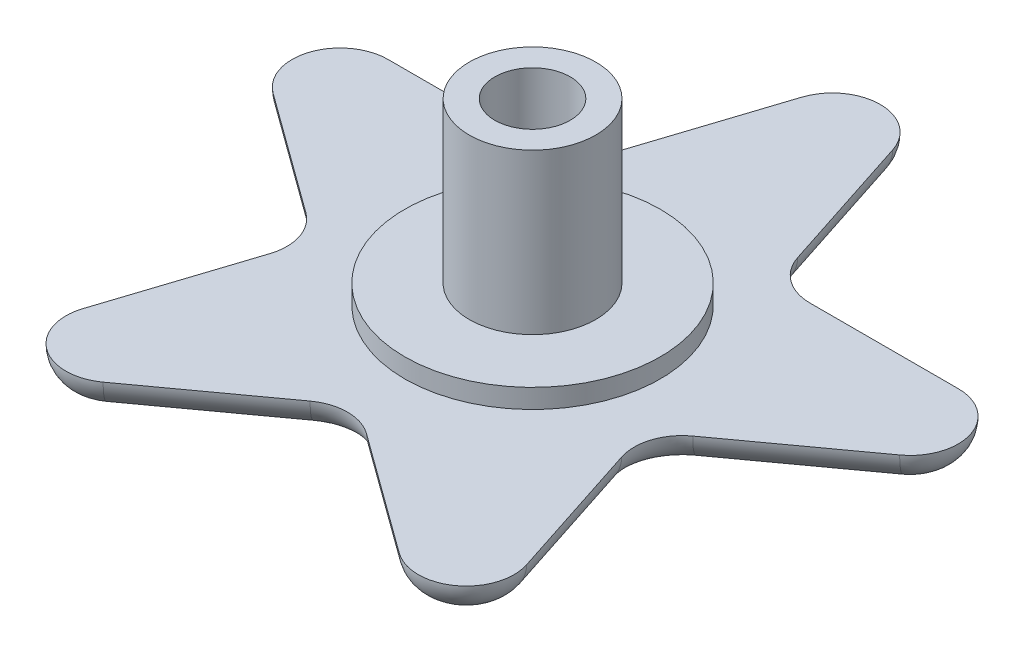
from build123d import *

# Parameters (mm, degrees)
SALIENTE_EXTRUIR1_DEPTH = 1
REDONDEO1_R             = 1
CROQUIS5_R              = 4
SALIENTE_EXTRUIR5_DEPTH = 0.6
CROQUIS2_R              = 1.98
CROQUIS2_R_2            = 1.18
SALIENTE_EXTRUIR2_DEPTH = 5


with BuildPart() as part:
    # Croquis1 → Saliente-Extruir1 (new body)
    with BuildSketch(Plane(origin=(0, 0, 0), x_dir=(1, 0, 0), z_dir=(0, 1, 0))):
        with BuildLine():
            Line((1.426584774, 9.845491503), (2.859425417, 5.435661447))
            ThreePointArc((2.859425417, 5.435661447), (3.404332313, 4.685661447), (4.286010191, 4.399186938))
            Line((4.286010191, 4.399186938), (8.922779911, 4.399186938))
            ThreePointArc((8.922779911, 4.399186938), (10.349364685, 3.36271243), (9.804457789, 1.685661447))
            Line((9.804457789, 1.685661447), (6.053232287, -1.039763413))
            ThreePointArc((6.053232287, -1.039763413), (5.508325391, -1.789763413), (5.508325391, -2.716814396))
            Line((5.508325391, -2.716814396), (6.941166033, -7.126644452))
            ThreePointArc((6.941166033, -7.126644452), (6.396259137, -8.803695435), (4.63290338, -8.803695435))
            Line((4.63290338, -8.803695435), (0.881677878, -6.078270576))
            ThreePointArc((0.881677878, -6.078270576), (0, -5.791796068), (-0.881677878, -6.078270576))
            Line((-0.881677878, -6.078270576), (-4.63290338, -8.803695435))
            ThreePointArc((-4.63290338, -8.803695435), (-6.396259137, -8.803695435), (-6.941166033, -7.126644452))
            Line((-6.941166033, -7.126644452), (-5.508325391, -2.716814396))
            ThreePointArc((-5.508325391, -2.716814396), (-5.508325391, -1.789763413), (-6.053232287, -1.039763413))
            Line((-6.053232287, -1.039763413), (-9.804457789, 1.685661447))
            ThreePointArc((-9.804457789, 1.685661447), (-10.349364685, 3.36271243), (-8.922779911, 4.399186938))
            Line((-8.922779911, 4.399186938), (-4.286010191, 4.399186938))
            ThreePointArc((-4.286010191, 4.399186938), (-3.404332313, 4.685661447), (-2.859425417, 5.435661447))
            Line((-2.859425417, 5.435661447), (-1.426584774, 9.845491503))
            ThreePointArc((-1.426584774, 9.845491503), (0, 10.881966011), (1.426584774, 9.845491503))
        make_face()
    extrude(amount=SALIENTE_EXTRUIR1_DEPTH)

    # Redondeo1
    redondeo1_edges = [part.edges().sort_by_distance(p)[0] for p in [
        (-6.224745712, 0, 4.921729424),
        (-6.396259137, 0, 8.803695435),
        (-2.757290629, 0, 7.440983006),
        (0, 0, 5.791796068),
        (2.757290629, 0, 7.440983006),
        (6.396259137, 0, 8.803695435),
        (6.224745712, 0, 4.921729424),
        (5.508325391, 0, 1.789763413),
        (7.928845038, 0, -0.322949017),
        (10.349364685, 0, -3.36271243),
        (6.604395051, 0, -4.399186938),
        (3.404332313, 0, -4.685661447),
        (2.143005096, 0, -7.640576475),
        (0, 0, -10.881966011),
        (-2.143005096, 0, -7.640576475),
        (-3.404332313, 0, -4.685661447),
        (-6.604395051, 0, -4.399186938),
        (-10.349364685, 0, -3.36271243),
        (-7.928845038, 0, -0.322949017),
        (-5.508325391, 0, 1.789763413),
    ]]
    fillet(redondeo1_edges, radius=REDONDEO1_R - 0.0001)  # a hair under: the kernel refuses the full size

    # Croquis5 → Saliente-Extruir5 (add)
    with BuildSketch(Plane(origin=(0, 1, 0), x_dir=(1, 0, 0), z_dir=(0, 1, 0))):
        with Locations(Location((0, 0, 0), (0, 0, 270))):
            Circle(CROQUIS5_R)
    extrude(amount=SALIENTE_EXTRUIR5_DEPTH)

    # Croquis2 → Saliente-Extruir2 (add)
    with BuildSketch(Plane(origin=(0, 1.6, 0), x_dir=(1, 0, 0), z_dir=(0, 1, 0))):
        with Locations(Location((0, 0, 0), (0, 0, 270))):
            Circle(CROQUIS2_R)
        with Locations(Location((0, 0, 0), (0, 0, 270))):
            Circle(CROQUIS2_R_2, mode=Mode.SUBTRACT)
    extrude(amount=SALIENTE_EXTRUIR2_DEPTH)


solid = part.part
